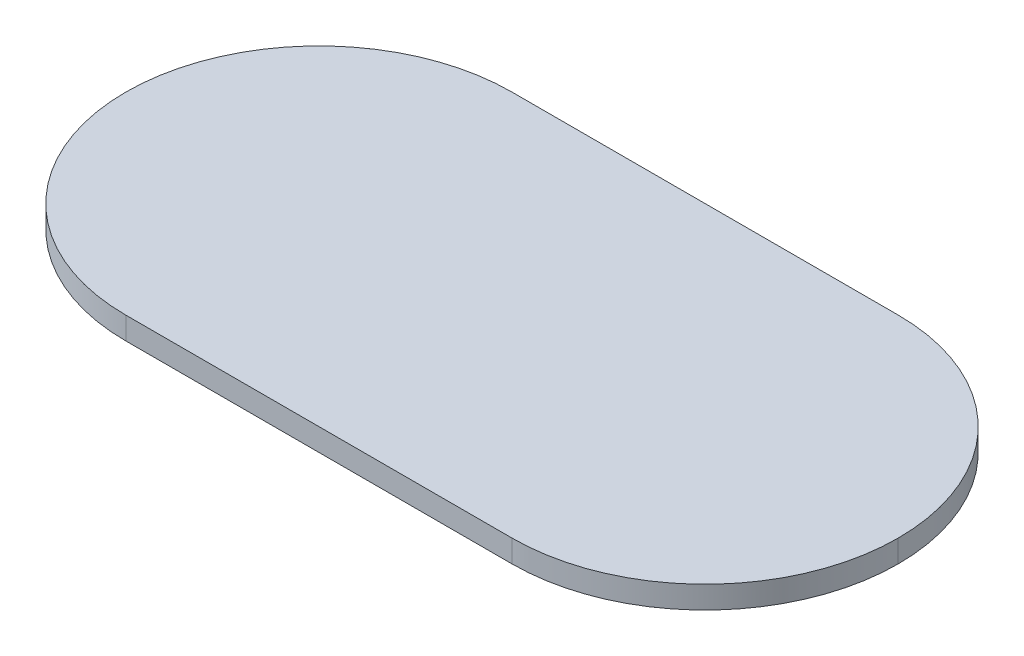
from build123d import *

# Parameters (mm, degrees)
SKETCH1_W           = 138
SKETCH1_H           = 69
BOSS_EXTRUDE1_DEPTH = 4
FILLET1_R           = 34.5


with BuildPart() as part:
    # Sketch1 → Boss-Extrude1 (new body)
    with BuildSketch(Plane(origin=(0, 0, 0), x_dir=(1, 0, 0), z_dir=(0, 1, 0))):
        Rectangle(SKETCH1_W, SKETCH1_H)
    extrude(amount=BOSS_EXTRUDE1_DEPTH)

    # Fillet1
    fillet1_edges = [part.edges().sort_by_distance(p)[0] for p in [
        (69, 2, 34.5),
        (69, 2, -34.5),
        (-69, 2, -34.5),
        (-69, 2, 34.5),
    ]]
    fillet(fillet1_edges, radius=FILLET1_R - 0.0001)  # a hair under: the kernel refuses the full size


solid = part.part
